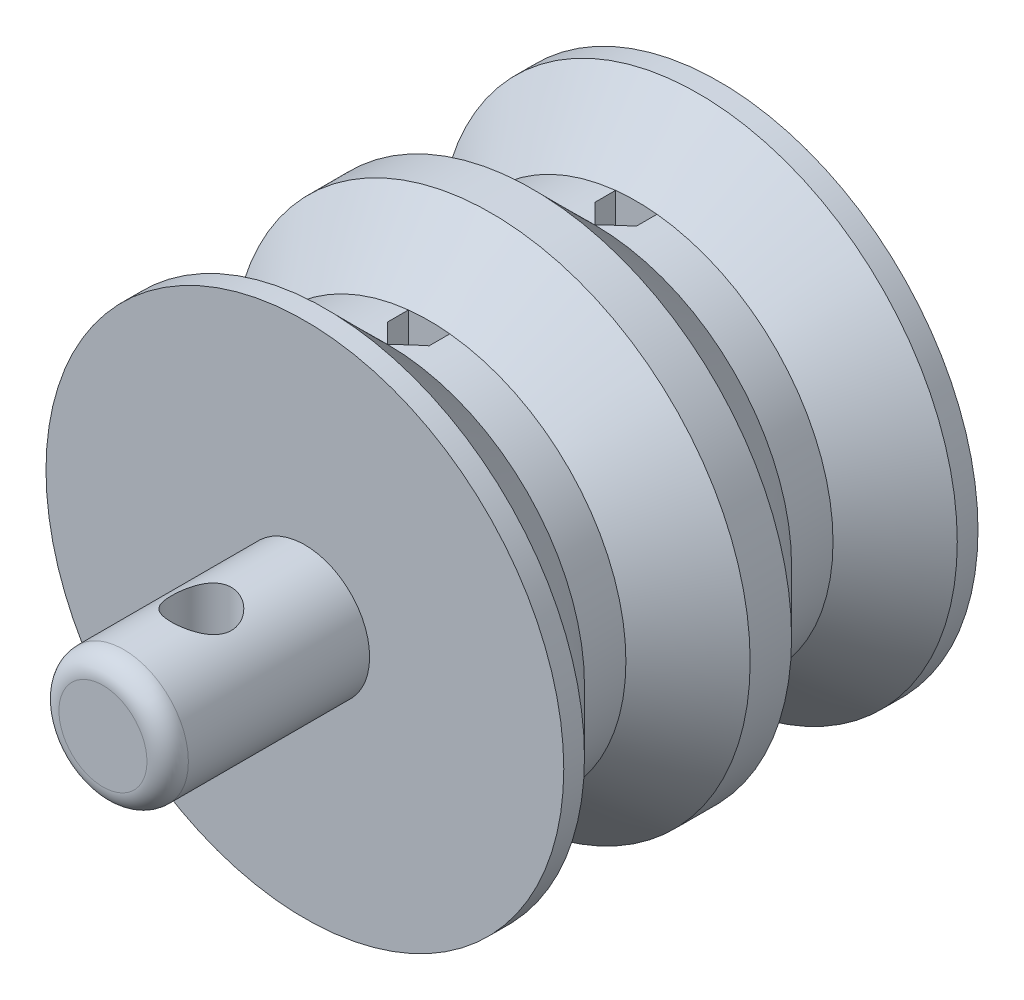
from build123d import *

# Parameters (mm, degrees)
ESQUISSE1_R                  = 3.125
BOSS_EXTRU_1_DEPTH           = 9.75
CONG_1_R                     = 1
ESQUISSE2_R                  = 12.5
BOSS_EXTRU_3_DEPTH           = 20
ENL_V_MAT_EXTRU_1_DEPTH      = 27.69269563
ENL_V_MAT_EXTRU_1_DEPTH_BACK = 27.69269563
ESQUISSE6_R                  = 1.45
ENL_V_MAT_EXTRU_2_DEPTH      = 33.252906846
R_P_TITION_LIN_AIRE1_COUNT   = 2
R_P_TITION_LIN_AIRE1_PITCH   = 10


with BuildPart() as part:
    # Esquisse1 → Boss.-Extru.1 (new body)
    with BuildSketch(Plane.XY):
        Circle(ESQUISSE1_R)
    extrude(amount=BOSS_EXTRU_1_DEPTH)

    # Congé1
    cong_1_edges = [part.edges().sort_by_distance(p)[0] for p in [
        (-3.125, 0, 9.75),
    ]]
    fillet(cong_1_edges, radius=CONG_1_R)

    # Esquisse2 → Boss.-Extru.3 (add)
    with BuildSketch(Plane(origin=(0, 0, 0), x_dir=(-1, 0, 0), z_dir=(0, 0, -1))):
        Circle(ESQUISSE2_R)
    extrude(amount=BOSS_EXTRU_3_DEPTH)

    # Esquisse5 → Enlèvement de matière-Révolution1 (revolve, cut)
    with BuildSketch(Plane(origin=(0, 0, 0), x_dir=(0, 0, -1), z_dir=(1, 0, 0))):
        Polygon((1, 12.5), (4, 9.5), (6, 9.5), (9, 12.5), align=None)
        Polygon((11, 12.5), (19, 12.5), (16, 9.5), (14, 9.5), align=None)
    revolve(axis=Axis((0, 0, 0), (0, 0, -1)), mode=Mode.SUBTRACT)

    # Esquisse6 → Enlèv. mat.-Extru.1 (cut, two sides: drawn at the far end of the back side and taken through both)
    with BuildSketch(Plane(origin=(0, 0, 0), x_dir=(1, 0, 0), z_dir=(0, 1, 0)).offset(-ENL_V_MAT_EXTRU_1_DEPTH_BACK)):
        with Locations((0, -5)):
            Circle(ESQUISSE6_R)
    extrude(amount=ENL_V_MAT_EXTRU_1_DEPTH + ENL_V_MAT_EXTRU_1_DEPTH_BACK, mode=Mode.SUBTRACT)

    # Esquisse7 → Enlèv. mat.-Extru.2 (cut, symmetric)
    with BuildSketch(Plane(origin=(0, 9.5, 0), x_dir=(1, 0, 0), z_dir=(0, 1, 0))):
        Polygon((0, 14), (1, 15), (1, 16), (-1, 16), (-1, 15), align=None)
    enl_v_mat_extru_2 = extrude(amount=ENL_V_MAT_EXTRU_2_DEPTH, both=True, mode=Mode.SUBTRACT)

    # Répétition linéaire1: Enlèv. mat.-Extru.2 ×2
    with Locations(*[(0, 0, i * R_P_TITION_LIN_AIRE1_PITCH) for i in range(1, R_P_TITION_LIN_AIRE1_COUNT)]):
        add(enl_v_mat_extru_2, mode=Mode.SUBTRACT)


solid = part.part
